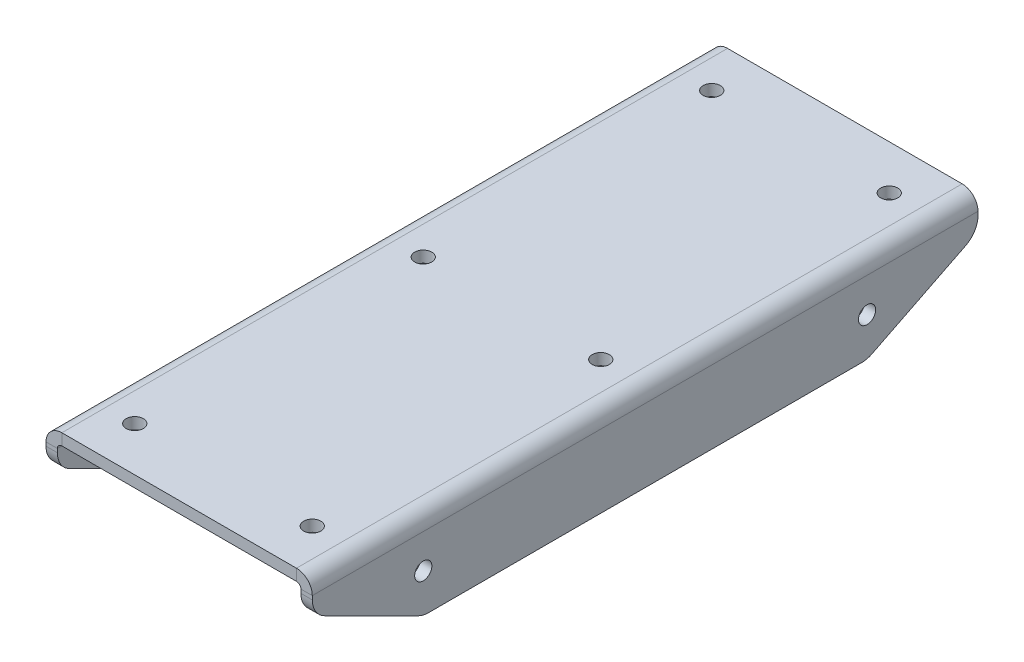
from build123d import *

# Parameters (mm, degrees)
SKETCH1_W                      = 76.2
SKETCH1_H                      = 190.5
BASE_FLANGE1_DEPTH             = 3.2639
EDGE_FLANGE1_STRIP_W           = 15.5956
EDGE_FLANGE1_STRIP_H           = 3.2639
EDGE_FLANGE1_STRIP_CUT_DEPTH   = 190.5
EDGE_FLANGE1_STRIP_2_W         = 15.5956
EDGE_FLANGE1_STRIP_2_H         = 3.2639
EDGE_FLANGE1_STRIP_CUT_2_DEPTH = 190.5
EDGE_FLANGE1_DEPTH             = 190.5
EDGE_FLANGE1_BEND_DEPTH        = 190.5
F_10_0_1935_DIAMETER_HOLE1_D   = 4.9149
F_10_0_1935_DIAMETER_HOLE2_D   = 4.9149
CUT_EXTRUDE1_DEPTH             = 125.595997127
FILLET2_R                      = 6.35


# Sheet-metal steps are written as plain solids
with BuildPart() as part:
    # Sketch1 → Base-Flange1 (new body)
    with BuildSketch(Plane(origin=(0, 0, 0), x_dir=(1, 0, 0), z_dir=(0, 1, 0))):
        Rectangle(SKETCH1_W, SKETCH1_H)
    extrude(amount=-BASE_FLANGE1_DEPTH)

    # Edge-Flange1 strip (across the edge) → Edge-Flange1 strip cut (cut)
    with BuildSketch(Plane(origin=(38.1, -3.2639, -95.25), x_dir=(-1, 0, 0), z_dir=(0, 0, 1))):
        with Locations((-3.2639, -1.63195)):
            Rectangle(EDGE_FLANGE1_STRIP_W, EDGE_FLANGE1_STRIP_H)
    extrude(amount=EDGE_FLANGE1_STRIP_CUT_DEPTH, mode=Mode.SUBTRACT)

    # Edge-Flange1 strip 2 (across the edge) → Edge-Flange1 strip cut 2 (cut)
    with BuildSketch(Plane(origin=(-38.1, -3.2639, 95.25), x_dir=(1, 0, 0), z_dir=(0, 0, -1))):
        with Locations((-3.2639, -1.63195)):
            Rectangle(EDGE_FLANGE1_STRIP_2_W, EDGE_FLANGE1_STRIP_2_H)
    extrude(amount=EDGE_FLANGE1_STRIP_CUT_2_DEPTH, mode=Mode.SUBTRACT)

    # Edge-Flange1 section (across the edge) → Edge-Flange1 (add)
    with BuildSketch(Plane(origin=(38.1, -3.2639, -95.25), x_dir=(-1, 0, 0), z_dir=(0, 0, 1))):
        with BuildLine():
            Line((0, 1.27), (0, 22.1361))
            Line((0, 22.1361), (3.2639, 22.1361))
            Line((3.2639, 22.1361), (3.2639, 1.27))
            ThreePointArc((3.2639, 1.27), (3.635874388, 0.371974388), (4.5339, 0))
            Line((4.5339, 0), (4.5339, -3.2639))
            ThreePointArc((4.5339, -3.2639), (1.327948565, -1.935951435), (0, 1.27))
        make_face()
    extrude(amount=EDGE_FLANGE1_DEPTH)

    # Edge-Flange1 section 2 (across the edge) → Edge-Flange1 bend (add)
    with BuildSketch(Plane(origin=(-38.1, -3.2639, 95.25), x_dir=(1, 0, 0), z_dir=(0, 0, -1))):
        with BuildLine():
            Line((0, 1.27), (0, 22.1361))
            Line((0, 22.1361), (3.2639, 22.1361))
            Line((3.2639, 22.1361), (3.2639, 1.27))
            ThreePointArc((3.2639, 1.27), (3.635874388, 0.371974388), (4.5339, 0))
            Line((4.5339, 0), (4.5339, -3.2639))
            ThreePointArc((4.5339, -3.2639), (1.327948565, -1.935951435), (0, 1.27))
        make_face()
    extrude(amount=EDGE_FLANGE1_BEND_DEPTH)

    # #10 (0.1935) Diameter Hole1 (through all)
    with Locations(Plane(origin=(0, 0, 0), x_dir=(1, 0, 0), z_dir=(0, 1, 0))):
        with Locations((-25.4, 82.55), (25.4, 82.55), (-25.4, 0), (25.4, 0), (25.4, -82.55), (-25.4, -82.55)):
            Hole(F_10_0_1935_DIAMETER_HOLE1_D / 2)

    # #10 (0.1935) Diameter Hole2 (through all)
    with Locations(Plane(origin=(38.1, 0, 0), x_dir=(0, 0, -1), z_dir=(1, 0, 0))):
        with Locations((-63.5, -14.2875), (63.5, -14.2875)):
            Hole(F_10_0_1935_DIAMETER_HOLE2_D / 2)

    # Sketch19 → Cut-Extrude1 (cut, through all)
    with BuildSketch(Plane(origin=(38.1, 0, 0), x_dir=(0, 0, -1), z_dir=(1, 0, 0))):
        Polygon((-95.25, -9.525), (-63.5, -25.4), (-95.25, -25.4), align=None)
        Polygon((63.5, -25.4), (95.25, -25.4), (95.25, -9.525), align=None)
    extrude(amount=-CUT_EXTRUDE1_DEPTH, mode=Mode.SUBTRACT)

    # Fillet2
    fillet2_edges = [part.edges().sort_by_distance(p)[0] for p in [
        (36.46805, -25.4, 63.5),
        (36.46805, -9.525, 95.25),
        (-36.46805, -9.525, 95.25),
        (-36.46805, -25.4, 63.5),
        (36.46805, -25.4, -63.5),
        (36.46805, -9.525, -95.25),
        (-36.46805, -25.4, -63.5),
        (-36.46805, -9.525, -95.25),
    ]]
    fillet(fillet2_edges, radius=FILLET2_R)


solid = part.part
